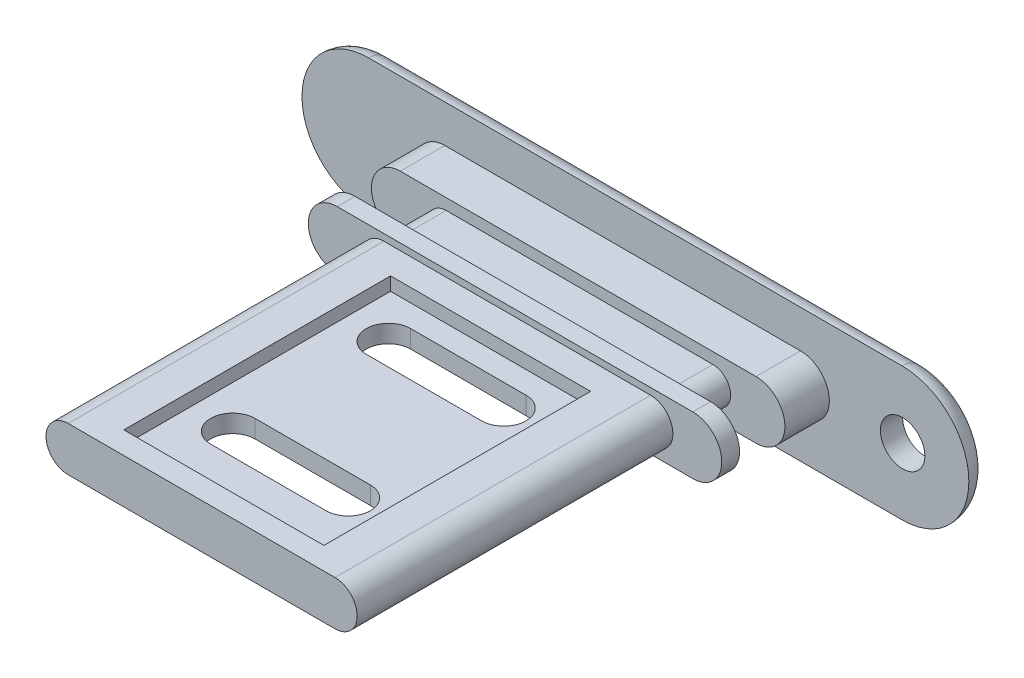
from build123d import *

# Parameters (mm, degrees)
EXTRUDE_2_DEPTH     = 0.5
SKETCH_6_R          = 0.5
CUT_EXTRUDE_1_DEPTH = 8.917160087
EXTRUDE_3_DEPTH     = 1
EXTRUDE_4_DEPTH     = 1
EXTRUDE_5_DEPTH     = 0.4
EXTRUDE_6_DEPTH     = 7.1
SKETCH_11_W         = 4.5
SKETCH_11_H         = 6
CUT_EXTRUDE_2_DEPTH = 0.3
SKETCH_13_W         = 4.5
SKETCH_13_H         = 6
CUT_EXTRUDE_3_DEPTH = 0.3
CUT_EXTRUDE_4_DEPTH = 13.769942202
FILLET_2_R          = 0.5


with BuildPart() as part:
    # 草图5 → 凸台-拉伸2 (new body)
    with BuildSketch(Plane.XY):
        with BuildLine():
            Line((-5.742331288, 1.5), (6.257668712, 1.5))
            ThreePointArc((6.257668712, 1.5), (7.757668712, 0), (6.257668712, -1.5))
            Line((6.257668712, -1.5), (-5.742331288, -1.5))
            ThreePointArc((-5.742331288, -1.5), (-7.242331288, 0), (-5.742331288, 1.5))
        make_face()
    extrude(amount=EXTRUDE_2_DEPTH)

    # 草图6 → 切除-拉伸1 (cut, through all)
    with BuildSketch(Plane(origin=(0, 0, 0), x_dir=(-1, 0, 0), z_dir=(0, 0, -1))):
        with Locations((-6.26778509, 0)):
            Circle(SKETCH_6_R)
    extrude(amount=-CUT_EXTRUDE_1_DEPTH, mode=Mode.SUBTRACT)

    # 草图7 → 凸台-拉伸3 (add)
    with BuildSketch(Plane.XY.offset(0.5)):
        with BuildLine():
            Line((3.97045961, -0.65), (-4.02954039, -0.65))
            ThreePointArc((-4.02954039, -0.65), (-4.67954039, 0), (-4.02954039, 0.65))
            Line((-4.02954039, 0.65), (3.97045961, 0.65))
            ThreePointArc((3.97045961, 0.65), (4.62045961, 0), (3.97045961, -0.65))
        make_face()
    extrude(amount=EXTRUDE_3_DEPTH)

    # 草图8 → 凸台-拉伸4 (add)
    with BuildSketch(Plane.XY.offset(1.5)):
        with BuildLine():
            Line((3, -0.4), (-3, -0.4))
            ThreePointArc((-3, -0.4), (-3.4, 0), (-3, 0.4))
            Line((-3, 0.4), (3, 0.4))
            ThreePointArc((3, 0.4), (3.4, 0), (3, -0.4))
        make_face()
    extrude(amount=EXTRUDE_4_DEPTH)

    # 草图9 → 凸台-拉伸5 (add)
    with BuildSketch(Plane.XY.offset(2.5)):
        with BuildLine():
            Line((-4.050467807, 0.65), (3.949532193, 0.65))
            ThreePointArc((3.949532193, 0.65), (4.599532193, 0), (3.949532193, -0.65))
            Line((3.949532193, -0.65), (-4.050467807, -0.65))
            ThreePointArc((-4.050467807, -0.65), (-4.700467807, 0), (-4.050467807, 0.65))
        make_face()
    extrude(amount=EXTRUDE_5_DEPTH)

    # 草图10 → 凸台-拉伸6 (add)
    with BuildSketch(Plane.XY.offset(2.9)):
        with BuildLine():
            Line((-3, 0.5), (3, 0.5))
            ThreePointArc((3, 0.5), (3.5, 0), (3, -0.5))
            Line((3, -0.5), (-3, -0.5))
            ThreePointArc((-3, -0.5), (-3.5, 0), (-3, 0.5))
        make_face()
    extrude(amount=EXTRUDE_6_DEPTH)

    # 草图11 → 切除-拉伸2 (cut)
    with BuildSketch(Plane(origin=(0, -0.5, 0), x_dir=(-1, 0, 0), z_dir=(0, -1, 0))):
        with Locations((0, -6.5)):
            Rectangle(SKETCH_11_W, SKETCH_11_H)
    extrude(amount=-CUT_EXTRUDE_2_DEPTH, mode=Mode.SUBTRACT)

    # 草图13 → 切除-拉伸3 (cut)
    with BuildSketch(Plane(origin=(0, 0.5, 0), x_dir=(1, 0, 0), z_dir=(0, 1, 0))):
        with Locations((0, -6.5)):
            Rectangle(SKETCH_13_W, SKETCH_13_H)
    extrude(amount=-CUT_EXTRUDE_3_DEPTH, mode=Mode.SUBTRACT)

    # 草图14 → 切除-拉伸4 (cut, through all)
    with BuildSketch(Plane(origin=(0, 0.2, 0), x_dir=(1, 0, 0), z_dir=(0, 1, 0))):
        with BuildLine():
            Line((1.297759643, -5), (-1.297759643, -5))
            ThreePointArc((-1.297759643, -5), (-1.797759643, -4.5), (-1.297759643, -4))
            Line((-1.297759643, -4), (1.297759643, -4))
            ThreePointArc((1.297759643, -4), (1.797759643, -4.5), (1.297759643, -5))
        make_face()
        with BuildLine():
            Line((1.297759643, -8.5), (-1.297759643, -8.5))
            ThreePointArc((-1.297759643, -8.5), (-1.797759643, -8), (-1.297759643, -7.5))
            Line((-1.297759643, -7.5), (1.297759643, -7.5))
            ThreePointArc((1.297759643, -7.5), (1.797759643, -8), (1.297759643, -8.5))
        make_face()
    extrude(amount=-CUT_EXTRUDE_4_DEPTH, mode=Mode.SUBTRACT)

    # 圆角2
    fillet_2_edges = [part.edges().sort_by_distance(p)[0] for p in [
        (-7.242331288, 0, 0),
        (0.257668712, 1.5, 0),
        (7.757668712, 0, 0),
        (0.257668712, -1.5, 0),
    ]]
    fillet(fillet_2_edges, radius=FILLET_2_R - 0.0001)  # a hair under: the kernel refuses the full size


solid = part.part
